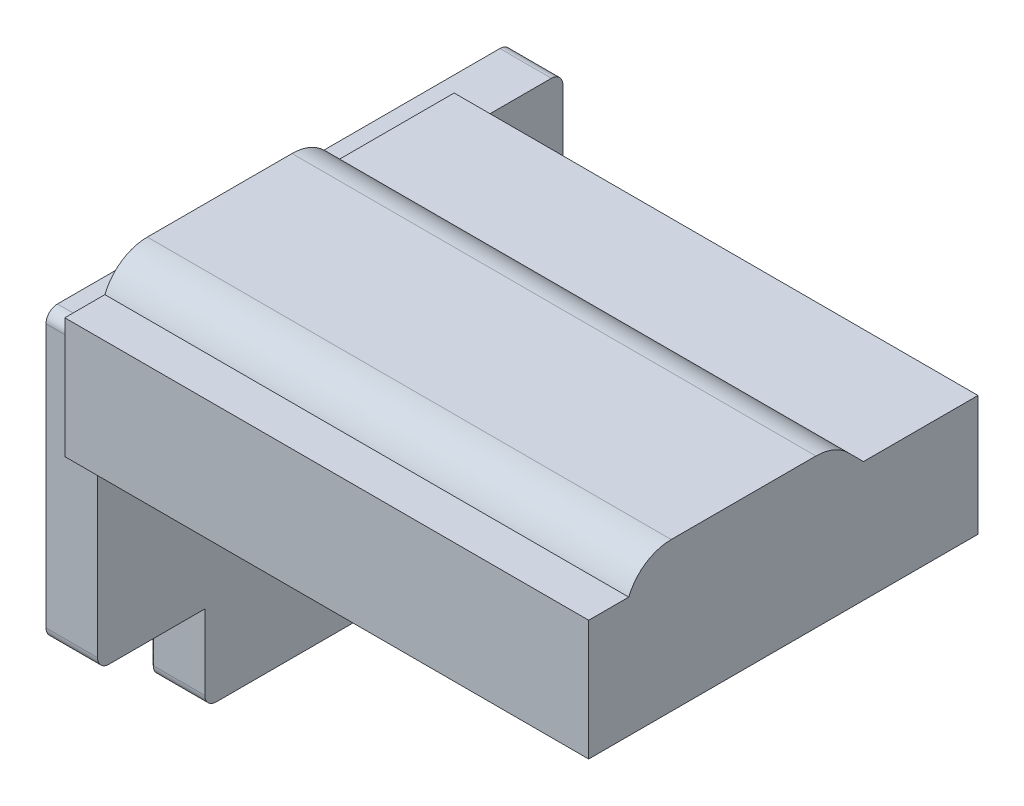
from build123d import *

# Parameters (mm, degrees)
SKETCH1_W           = 915
SKETCH1_H           = 680
BOSS_EXTRUDE1_DEPTH = 210
BOSS_EXTRUDE2_DEPTH = 915
FILLET1_R           = 80
SKETCH5_W           = 438.15
SKETCH5_H           = 150.725
SKETCH5_W_2         = 622.85
SKETCH5_H_2         = 147.32
BOSS_EXTRUDE3_DEPTH = 90
FILLET2_R           = 20


with BuildPart() as part:
    # Sketch1 → Boss-Extrude1 (new body)
    with BuildSketch(Plane(origin=(0, 0, 0), x_dir=(1, 0, 0), z_dir=(0, 1, 0))):
        with Locations((0, 340)):
            Rectangle(SKETCH1_W, SKETCH1_H)
    extrude(amount=-BOSS_EXTRUDE1_DEPTH)

    # Sketch3 → Boss-Extrude2 (add)
    with BuildSketch(Plane.ZY.offset(457.5)):
        Polygon((-70, 0), (-70, 50), (-430, 50), (-480, 0), align=None)
    extrude(amount=-BOSS_EXTRUDE2_DEPTH)

    # Fillet1
    # the kernel refuses this fillet: 80 mm, written as the material it takes off along each edge
    with BuildSketch(Plane(origin=(-642.904962177, 50, -70), x_dir=(0, -1, 0), z_dir=(1, 0, 0))) as fillet1_piece_1:
        with BuildLine():
            CenterArc((80, 74.161984871), FILLET1_R, 180, 67.975687163)
            Line((0, 74.161984871), (-1.6, 74.161984871))
            Line((-1.6, 74.161984871), (-1.6, 0))
            Line((-1.6, 0), (0, -1.6))
            ThreePointArc((0, -1.6), (25, -1.6), (49.4, -1.483239697))
            Line((49.4, -1.483239697), (50, 0))
        make_face()
    extrude(amount=1285.809924355, mode=Mode.SUBTRACT)
    with BuildSketch(Plane(origin=(-540.342712475, 50, -430), x_dir=(0, -0.7071067811865477, -0.7071067811865474), z_dir=(1, 0, 0))) as fillet1_piece_2:
        with BuildLine():
            CenterArc((FILLET1_R * 0.414213562373, -FILLET1_R), FILLET1_R, 90, 45)
            Line((-FILLET1_R * 0.292893218813, -FILLET1_R * 0.292893218813), (-FILLET1_R * 0.307035354437, -FILLET1_R * 0.27875108319))
            Line((-FILLET1_R * 0.307035354437, -FILLET1_R * 0.27875108319), (-FILLET1_R * 0.00828427124746, FILLET1_R * 0.02))
            Line((-FILLET1_R * 0.00828427124746, FILLET1_R * 0.02), (FILLET1_R * 0.414213562373, FILLET1_R * 0.02))
            Line((FILLET1_R * 0.414213562373, FILLET1_R * 0.02), (FILLET1_R * 0.414213562373, 0))
        make_face()
    extrude(amount=1080.685424949, mode=Mode.SUBTRACT)


with BuildPart() as body_2:
    # Sketch5 → Boss-Extrude3 (new body)
    with BuildSketch(Plane.ZY.offset(457.5)):
        Polygon((-680, -210), (-680, -62.68), (-869.95, -62.68), (-869.95, -562.68), (-682.625, -562.68), (-244.475, -562.68), (-57.15, -562.68), (-57.15, -210), align=None)
        with Locations((-463.55, -638.0425)):
            Rectangle(SKETCH5_W, SKETCH5_H)
        with Locations((-368.575, -136.34)):
            Rectangle(SKETCH5_W_2, SKETCH5_H_2)
    extrude(amount=BOSS_EXTRUDE3_DEPTH)

    # Fillet2
    fillet2_edges = [body_2.edges().sort_by_distance(p)[0] for p in [
        (-502.5, -562.68, -57.15),
        (-502.5, -713.405, -244.475),
        (-502.5, -713.405, -682.625),
        (-502.5, -562.68, -869.95),
        (-502.5, -62.68, -869.95),
        (-502.5, -62.68, -57.15),
    ]]
    fillet(fillet2_edges, radius=FILLET2_R)


solid = Compound([part.part, body_2.part])
